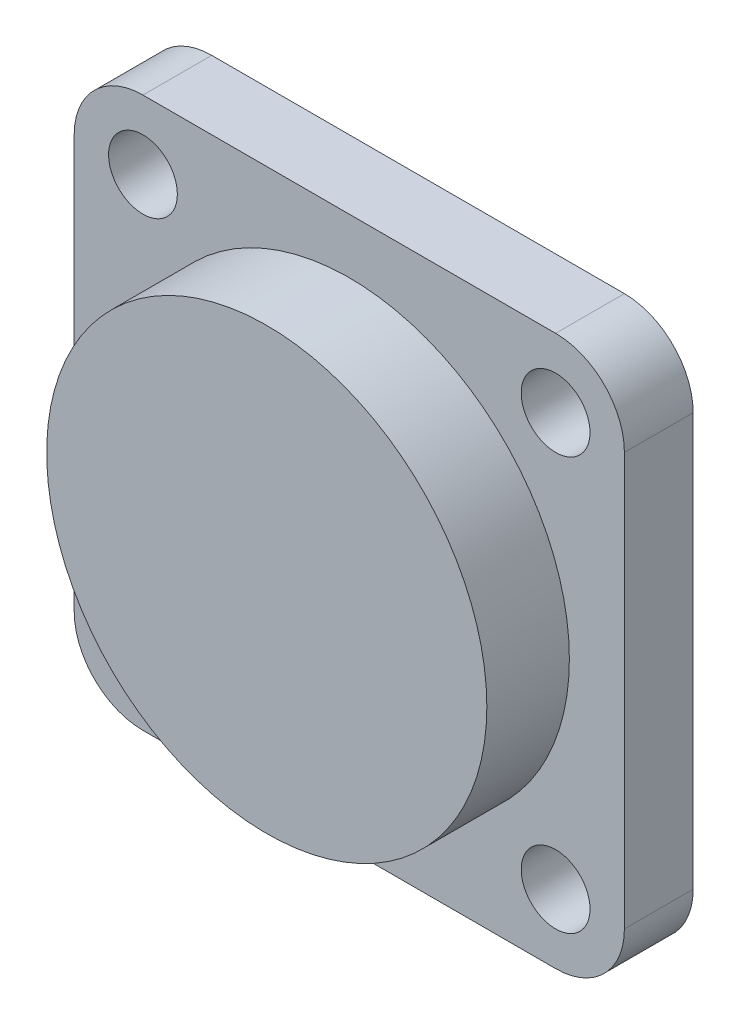
from build123d import *

# Parameters (mm, degrees)
SKETCH1_W           = 40
SKETCH1_H           = 40
SKETCH1_R           = 2.5
BOSS_EXTRUDE1_DEPTH = 5
SKETCH2_R           = 16
BOSS_EXTRUDE2_DEPTH = 6
FILLET2_R           = 5


with BuildPart() as part:
    # Sketch1 → Boss-Extrude1 (new body)
    with BuildSketch(Plane.XY):
        Rectangle(SKETCH1_W, SKETCH1_H)
        with Locations((-15, 15)):
            Circle(SKETCH1_R, mode=Mode.SUBTRACT)
        with Locations((15, 15)):
            Circle(SKETCH1_R, mode=Mode.SUBTRACT)
        with Locations((15, -15)):
            Circle(SKETCH1_R, mode=Mode.SUBTRACT)
        with Locations((-15, -15)):
            Circle(SKETCH1_R, mode=Mode.SUBTRACT)
    extrude(amount=BOSS_EXTRUDE1_DEPTH)

    # Sketch2 → Boss-Extrude2 (add)
    with BuildSketch(Plane.XY.offset(5)):
        Circle(SKETCH2_R)
    extrude(amount=BOSS_EXTRUDE2_DEPTH)

    # Fillet2
    fillet2_edges = [part.edges().sort_by_distance(p)[0] for p in [
        (-20, -20, 2.5),
        (20, -20, 2.5),
        (20, 20, 2.5),
        (-20, 20, 2.5),
    ]]
    fillet(fillet2_edges, radius=FILLET2_R)


solid = part.part
